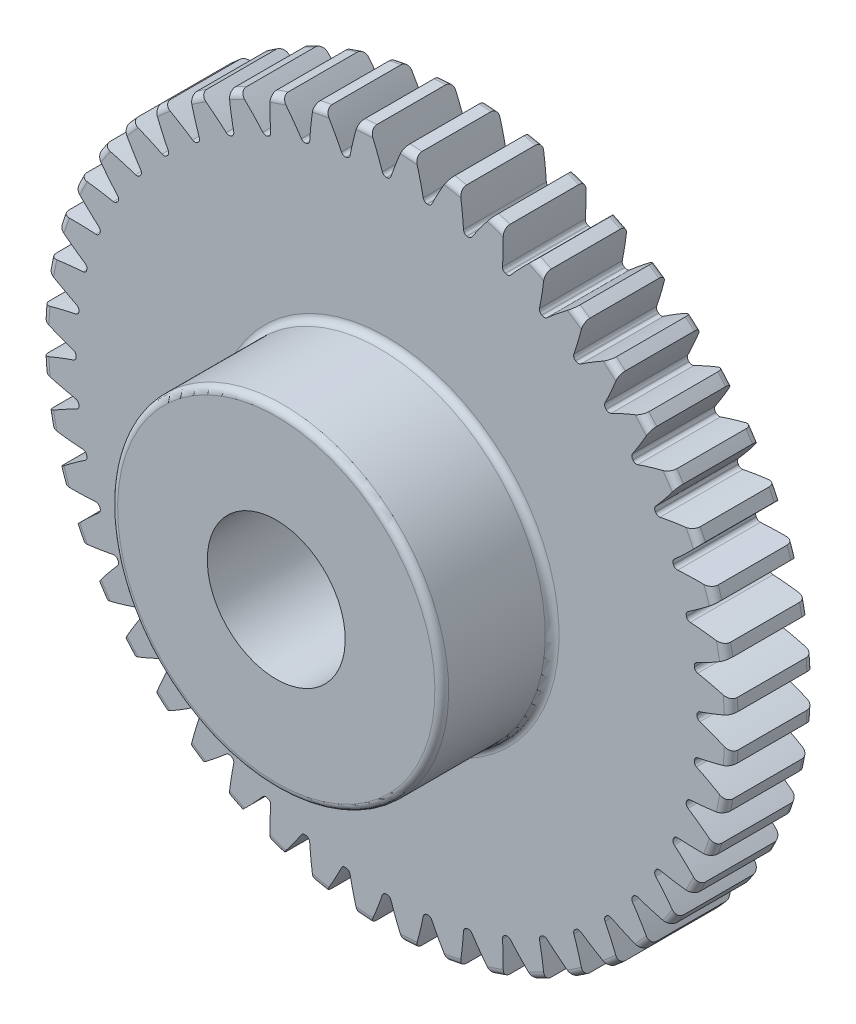
from build123d import *

# Parameters (mm, degrees)
FILLET2_R          = 0.25
CUT_EXTRUDE2_DEPTH = 19.12456896
CIRPATTERN1_COUNT  = 48


with BuildPart() as part:
    # Sketch4 → Revolve1 (revolve)
    with BuildSketch(Plane(origin=(0, 0, 0), x_dir=(0, 0, -1), z_dir=(1, 0, 0))):
        Polygon((-7, 2.5), (-7, 6), (-3, 6), (-3, 12.5), (0, 12.5), (0, 2.5), align=None)
    revolve(axis=Axis((0, 0, 3), (0, 0, 1)))

    # Fillet2
    fillet2_edges = [part.edges().sort_by_distance(p)[0] for p in [
        (0, -6, 7),
        (0, -6, 3),
        (0, -12.5, 3),
        (0, -12.5, 0),
    ]]
    fillet(fillet2_edges, radius=FILLET2_R)

    # Sketch7 → Cut-Extrude2 (cut, through all)
    with BuildSketch(Plane.XY.offset(3)):
        with BuildLine():
            ThreePointArc((-0.013730525, 11.249991621), (0, 11.25), (0.013730525, 11.249991621))
            ThreePointArc((0.013730525, 11.249991621), (0.101365894, 11.278119802), (0.156080652, 11.352129583))
            ThreePointArc((0.156080652, 11.352129583), (0.365129588, 11.924463901), (0.602960784, 12.485449063))
            ThreePointArc((0.602960784, 12.485449063), (0, 12.5), (-0.602960784, 12.485449063))
            ThreePointArc((-0.602960784, 12.485449063), (-0.365129588, 11.924463901), (-0.156080652, 11.352129583))
            ThreePointArc((-0.156080652, 11.352129583), (-0.101365894, 11.278119802), (-0.013730525, 11.249991621))
        make_face()
    cut_extrude2 = extrude(amount=-CUT_EXTRUDE2_DEPTH, mode=Mode.SUBTRACT)

    # CirPattern1: Cut-Extrude2 ×48 about axis
    cirpattern1_axis = Axis((0, 0, 7), (0, 0, -1))
    for i in range(1, CIRPATTERN1_COUNT):
        add(cut_extrude2.rotate(cirpattern1_axis, i * 360 / CIRPATTERN1_COUNT), mode=Mode.SUBTRACT)


solid = part.part
